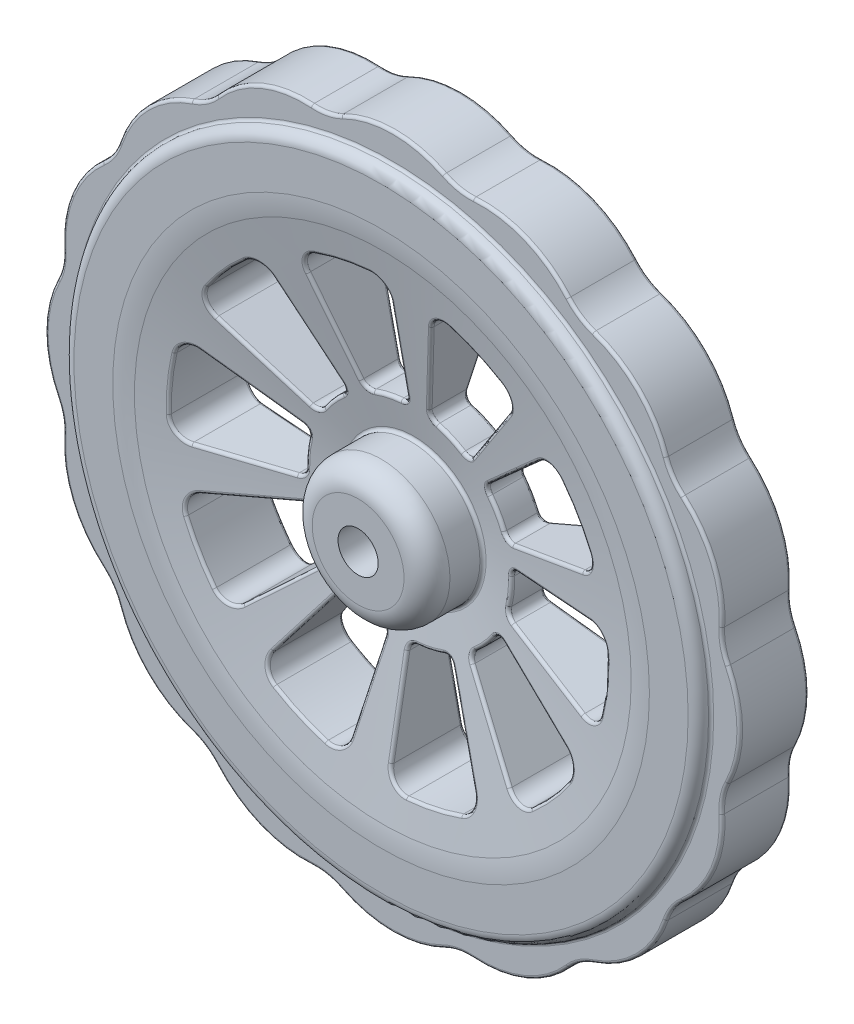
from build123d import *

# Parameters (mm, degrees)
CROQUIS1_R              = 27.75
SALIENTE_EXTRUIR1_DEPTH = 8
REDONDEO1_R             = 1
SALIENTE_EXTRUIR2_DEPTH = 3
MATRIZC1_COUNT          = 16
REDONDEO2_R             = 5
REDONDEO3_R             = 10
CROQUIS7_R              = 6
SALIENTE_EXTRUIR4_DEPTH = 10
CROQUIS8_R              = 1.75
CORTAR_EXTRUIR3_DEPTH   = 44.933188071
CORTAR_EXTRUIR4_DEPTH   = 10
MATRIZC2_COUNT          = 10
REDONDEO4_R             = 0.25
REDONDEO5_R             = 0.25
REDONDEO6_R             = 1
REDONDEO7_R             = 2


with BuildPart() as part:
    # Croquis1 → Saliente-Extruir1 (new body)
    with BuildSketch(Plane.XY):
        Circle(CROQUIS1_R)
    extrude(amount=SALIENTE_EXTRUIR1_DEPTH)

    # Redondeo1
    redondeo1_edges = [part.edges().sort_by_distance(p)[0] for p in [
        (-27.75, 0, 0),
        (-27.75, 0, 8),
    ]]
    fillet(redondeo1_edges, radius=REDONDEO1_R)

    # Croquis3 → Saliente-Extruir2 (add, symmetric)
    with BuildSketch(Plane.XY.offset(4)):
        with BuildLine():
            ThreePointArc((9.79229254, 22.27756179), (0, 30.25), (-9.79229254, 22.27756179))
            ThreePointArc((-9.79229254, 22.27756179), (0, 24.334723185), (9.79229254, 22.27756179))
        make_face()
    saliente_extruir2 = extrude(amount=SALIENTE_EXTRUIR2_DEPTH, both=True)

    # MatrizC1: Saliente-Extruir2 ×16 about axis
    matrizc1_axis = Axis((0, 0, 0), (0, 0, 1))
    for i in range(1, MATRIZC1_COUNT):
        add(saliente_extruir2.rotate(matrizc1_axis, i * 360 / MATRIZC1_COUNT))

    # Redondeo2
    redondeo2_edges = [part.edges().sort_by_distance(p)[0] for p in [
        (-5.666879134, 28.489325268, 4),
        (-16.137906425, 24.152083753, 4),
        (-24.152083753, 16.137906425, 4),
        (-28.489325268, 5.666879134, 4),
        (-28.489325268, -5.666879134, 4),
        (-24.152083753, -16.137906425, 4),
        (-16.137906425, -24.152083753, 4),
        (-5.666879134, -28.489325268, 4),
        (5.666879134, -28.489325268, 4),
        (16.137906425, -24.152083753, 4),
        (24.152083753, -16.137906425, 4),
        (28.489325268, -5.666879134, 4),
        (28.489325268, 5.666879134, 4),
        (24.152083753, 16.137906425, 4),
        (5.666879134, 28.489325268, 4),
        (16.137906425, 24.152083753, 4),
    ]]
    fillet(redondeo2_edges, radius=REDONDEO2_R)

    # Cortar-Extruir1 cone 1 section (through the dimple's axis) → Cortar-Extruir1 (revolve, cut)
    with BuildSketch(Plane(origin=(0, 0, 8), x_dir=(0, -1, 0), z_dir=(1, 0, 0))):
        Polygon((0, 0), (22.5, 0), (0, 3.967357066), align=None)
    revolve(axis=Axis((0, 0, 8), (0, 0, -1)), mode=Mode.SUBTRACT)

    # Cortar-Extruir2 cone 1 section (through the dimple's axis) → Cortar-Extruir2 (revolve, cut)
    with BuildSketch(Plane(origin=(-0.046732654, 0.087094209, 0), x_dir=(0, 1, 0), z_dir=(1, 0, 0))):
        Polygon((0, 0), (22.5, 0), (0, 3.967357066), align=None)
    revolve(axis=Axis((-0.046732654, 0.087094209, 0), (0, 0, 1)), mode=Mode.SUBTRACT)

    # Redondeo3
    redondeo3_edges = [part.edges().sort_by_distance(p)[0] for p in [
        (0, 22.5, 8),
        (-0.046732654, -22.412905791, 0),
    ]]
    fillet(redondeo3_edges, radius=REDONDEO3_R)

    # Croquis7 → Saliente-Extruir4 (add)
    with BuildSketch(Plane.XY):
        with Locations(Location((0, 0, 0), (0, 0, 215.534970989))):
            Circle(CROQUIS7_R)
    extrude(amount=SALIENTE_EXTRUIR4_DEPTH)

    # Croquis8 → Cortar-Extruir3 (cut, through all)
    with BuildSketch(Plane.XY.offset(10)):
        Circle(CROQUIS8_R)
    extrude(amount=-CORTAR_EXTRUIR3_DEPTH, mode=Mode.SUBTRACT)

    # Croquis9 → Cortar-Extruir4 (cut)
    with BuildSketch(Plane.XY.offset(8)):
        with BuildLine():
            Line((-7.260492383, 15.942682664), (-4.010153858, 8.805547477))
            ThreePointArc((-4.010153858, 8.805547477), (-3.61740682, 8.424643432), (-3.070438236, 8.411856889))
            ThreePointArc((-3.070438236, 8.411856889), (-1.898852741, 8.751073395), (-0.692038486, 8.927934253))
            ThreePointArc((-0.692038486, 8.927934253), (-0.199558752, 9.166265617), (0, 9.675691207))
            Line((0, 9.675691207), (0, 17.518101501))
            ThreePointArc((0, 17.518101501), (-0.484662529, 18.621074753), (-1.624905044, 19.010041038))
            ThreePointArc((-1.624905044, 19.010041038), (-4.045789675, 18.645470297), (-6.400060685, 17.973903302))
            ThreePointArc((-6.400060685, 17.973903302), (-7.276550516, 17.1473361), (-7.260492383, 15.942682664))
        make_face()
    cortar_extruir4 = extrude(amount=-CORTAR_EXTRUIR4_DEPTH, mode=Mode.SUBTRACT)

    # MatrizC2: Cortar-Extruir4 ×10 about axis
    matrizc2_axis = Axis((0, 0, 0), (0, 0, 1))
    for i in range(1, MATRIZC2_COUNT):
        add(cortar_extruir4.rotate(matrizc2_axis, i * 360 / MATRIZC2_COUNT), mode=Mode.SUBTRACT)

    # Redondeo4
    redondeo4_edges = [part.edges().sort_by_distance(p)[0] for p in [
        (-27.947355858, -11.576173829, 7),
        (-27.947355858, -11.576173829, 1),
        (-21.389980131, -21.389980131, 7),
        (-21.389980131, -21.389980131, 1),
        (-11.576173829, -27.947355858, 7),
        (-11.576173829, -27.947355858, 1),
        (0, -30.25, 7),
        (0, -30.25, 1),
        (11.576173829, -27.947355858, 7),
        (11.576173829, -27.947355858, 1),
        (21.389980131, -21.389980131, 7),
        (21.389980131, -21.389980131, 1),
        (27.947355858, -11.576173829, 7),
        (27.947355858, -11.576173829, 1),
        (30.25, 0, 7),
        (30.25, 0, 1),
        (27.947355858, 11.576173829, 7),
        (27.947355858, 11.576173829, 1),
        (21.389980131, 21.389980131, 7),
        (21.389980131, 21.389980131, 1),
        (11.576173829, 27.947355858, 1),
        (11.576173829, 27.947355858, 7),
        (0, 30.25, 7),
        (0, 30.25, 1),
        (-11.576173829, 27.947355858, 7),
        (-11.576173829, 27.947355858, 1),
        (-21.389980131, 21.389980131, 7),
        (-21.389980131, 21.389980131, 1),
        (-28.767724411, 5.722256167, 1),
        (-28.767724411, 5.722256167, 7),
        (-28.767724411, -5.722256167, 1),
        (-28.767724411, -5.722256167, 7),
        (-24.388099149, -16.295606871, 1),
        (-24.388099149, -16.295606871, 7),
        (-16.295606871, -24.388099149, 1),
        (-16.295606871, -24.388099149, 7),
        (-5.722256167, -28.767724411, 1),
        (-5.722256167, -28.767724411, 7),
        (5.722256167, -28.767724411, 1),
        (5.722256167, -28.767724411, 7),
        (16.295606871, -24.388099149, 1),
        (16.295606871, -24.388099149, 7),
        (24.388099149, -16.295606871, 1),
        (24.388099149, -16.295606871, 7),
        (28.767724411, -5.722256167, 1),
        (28.767724411, -5.722256167, 7),
        (28.767724411, 5.722256167, 1),
        (28.767724411, 5.722256167, 7),
        (24.388099149, 16.295606871, 1),
        (24.388099149, 16.295606871, 7),
        (16.295606871, 24.388099149, 1),
        (16.295606871, 24.388099149, 7),
        (5.722256167, 28.767724411, 7),
        (5.722256167, 28.767724411, 1),
        (-5.722256167, 28.767724411, 1),
        (-5.722256167, 28.767724411, 7),
        (-16.295606871, 24.388099149, 1),
        (-16.295606871, 24.388099149, 7),
        (-24.388099149, 16.295606871, 1),
        (-24.388099149, 16.295606871, 7),
        (-27.75, 0, 1),
        (-27.75, 0, 7),
        (-30.25, 0, 7),
        (-30.25, 0, 1),
        (-27.947355858, 11.576173829, 7),
        (-27.947355858, 11.576173829, 1),
    ]]
    fillet(redondeo4_edges, radius=REDONDEO4_R)

    # Redondeo5
    redondeo5_edges = [part.edges().sort_by_distance(p)[0] for p in [
        (5.345597431, -2.72480972, 2.895033444),
        (-7.27888971, 17.141782895, 0.700943168),
        (-4.045789651, 18.645470351, 0.619902858),
        (-0.626761481, 18.736366705, 0.677397067),
        (0, 13.596896578, 1.585200152),
        (-0.296797173, 9.078106738, 2.381385917),
        (-1.898852665, 8.751073444, 2.405146944),
        (-3.619926047, 8.425704258, 2.367728954),
        (-14.232645129, 12.706446834, 0.619520253),
        (-11.331308282, 14.779188275, 0.700787196),
        (-7.992055165, 11.000120236, 1.587123817),
        (-5.548924214, 7.301082048, 2.367577318),
        (-6.679956112, 5.963649402, 2.404762188),
        (-7.881084567, 4.688799213, 2.365275708),
        (14.053501889, 12.219737868, 0.687401947),
        (12.93141778, 4.201672337, 1.566704615),
        (8.658449353, 3.021184015, 2.347555223),
        (7.735987641, 4.51014668, 2.388919065),
        (6.89470236, 6.046441077, 2.354207683),
        (10.027072843, 9.183323249, 1.574092971),
        (4.18694089, 18.146417203, 0.696678654),
        (5.229026134, 7.533498225, 2.358209719),
        (3.607547898, 8.1958847, 2.399075033),
        (11.331306642, -14.77918808, 0.666385406),
        (7.992055164, -11.000120235, 1.552588622),
        (5.548924508, -7.301079498, 2.333152275),
        (6.67995611, -5.963649405, 2.372013536),
        (7.881085707, -4.688798949, 2.335408617),
        (11.832394761, -6.698509696, 1.555102864),
        (18.5521031, 1.625534848, 0.676680371),
        (18.983113844, -1.913992501, 0.593380933),
        (17.854209544, -5.296238767, 0.67129683),
        (12.931417319, -4.201672187, 1.55724462),
        (8.780640355, -2.645120113, 2.338001217),
        (9.131939864, 0.839068747, 2.343487095),
        (13.50989422, 1.535699023, 1.563349722),
        (-18.552105796, -1.62553253, 0.690416428),
        (-17.854209043, 5.296239046, 0.695831459),
        (-12.931417334, 4.201672192, 1.582409328),
        (-8.780642777, 2.645124403, 2.362639086),
        (-8.909543189, 0.898313984, 2.398071826),
        (-9.131937169, -0.839065642, 2.357088015),
        (-13.509894234, -1.535699025, 1.576255427),
        (-14.053504272, -12.219737673, 0.679685012),
        (-16.482678304, -9.609541843, 0.602490031),
        (-17.557409387, -6.209692607, 0.686190415),
        (-12.931417788, -4.201672339, 1.572887116),
        (-7.735987644, -4.510146674, 2.387687099),
        (-6.894701889, -6.046435631, 2.346348397),
        (-4.186941159, -18.146417369, 0.670456163),
        (-10.554276946, -15.343732596, 0.675568441),
        (-5.2290299, -7.533498988, 2.342375545),
        (-2.023924944, -8.944273872, 2.337167652),
        (7.278890436, -17.141781164, 0.666231069),
        (4.045789651, -18.645470351, 0.586392563),
        (0.480230309, -18.616988753, 0.668013932),
        (0, -13.596896569, 1.554486217),
        (0.197706328, -9.168274521, 2.334816779),
        (1.898852668, -8.751073443, 2.371636769),
        (3.619924004, -8.425703393, 2.333003844),
        (5.635323122, -12.374115075, 1.552465917),
        (2.745615504, 5.334941003, 5.090604818),
        (-0.197706503, 9.168274331, 5.649632896),
        (0, 13.596896354, 6.430142615),
        (-0.480231444, 18.616989805, 7.3164125),
        (-4.045789685, 18.645470344, 7.396848871),
        (-5.635323121, 12.374115071, 6.430142615),
        (-3.619925019, 8.425703823, 5.649632896),
        (-1.898852748, 8.751073426, 5.611600858),
        (-5.548924361, 7.301080776, 5.649632896),
        (-7.992055154, 11.000120221, 6.430142615),
        (-11.331307449, 14.779188176, 7.3164125),
        (-14.232645101, 12.706446866, 7.396848871),
        (-7.881085306, 4.688799042, 5.649632896),
        (-6.679956044, 5.963649479, 5.611600858),
        (17.55740979, 6.209693478, 7.3164125),
        (16.482678302, 9.609541848, 7.396848871),
        (14.053502759, 12.219737797, 7.3164125),
        (7.735987637, 4.510146687, 5.611600858),
        (5.22902852, 7.533498709, 5.649632896),
        (7.992055154, 11.000120221, 6.430142615),
        (10.55427665, 15.343734097, 7.3164125),
        (4.186940899, 18.14641721, 7.3164125),
        (2.714250175, 13.323229205, 6.430142615),
        (2.023923588, 8.944276123, 5.649632896),
        (3.607547759, 8.195884762, 5.611600858),
        (5.548924361, -7.301080776, 5.649632896),
        (11.331307449, -14.779188176, 7.3164125),
        (14.232645101, -12.706446866, 7.396848871),
        (11.832394522, -6.69850956, 6.430142615),
        (7.881085306, -4.688799042, 5.649632896),
        (8.780641714, -2.64512252, 5.649632896),
        (12.931416879, -4.201672044, 6.430142615),
        (18.983113838, -1.913992561, 7.396848871),
        (18.552104227, 1.62553388, 7.3164125),
        (13.509893385, 1.535698928, 6.430142615),
        (8.909543175, -0.898314128, 5.611600858),
        (-8.780641714, 2.64512252, 5.649632896),
        (-12.931416879, 4.201672044, 6.430142615),
        (-17.854209145, 5.29623899, 7.3164125),
        (-13.509893385, -1.535698928, 6.430142615),
        (-8.909543175, 0.898314128, 5.611600858),
        (-8.658452376, -3.021182635, 5.649632896),
        (-12.931416879, -4.201672044, 6.430142615),
        (-17.55740979, -6.209693478, 7.3164125),
        (-16.482678302, -9.609541848, 7.396848871),
        (-14.053502759, -12.219737797, 7.3164125),
        (-10.027072158, -9.183322623, 6.430142615),
        (-6.894702176, -6.046438949, 5.649632896),
        (-5.22902852, -7.533498709, 5.649632896),
        (-7.686419879, -17.462557887, 7.396848871),
        (-4.186940899, -18.14641721, 7.3164125),
        (-3.607547759, -8.195884762, 5.611600858),
        (0.197706503, -9.168274331, 5.649632896),
        (0, -13.596896354, 6.430142615),
        (5.635323121, -12.374115071, 6.430142615),
        (3.619925019, -8.425703823, 5.649632896),
        (1.898852748, -8.751073426, 5.611600858),
    ]]
    fillet(redondeo5_edges, radius=REDONDEO5_R)

    # Redondeo6
    redondeo6_edges = [part.edges().sort_by_distance(p)[0] for p in [
        (4.882565577, 3.487198501, 0),
    ]]
    fillet(redondeo6_edges, radius=REDONDEO6_R)

    # Redondeo7
    redondeo7_edges = [part.edges().sort_by_distance(p)[0] for p in [
        (4.882565577, 3.487198501, 10),
    ]]
    fillet(redondeo7_edges, radius=REDONDEO7_R)


solid = part.part
